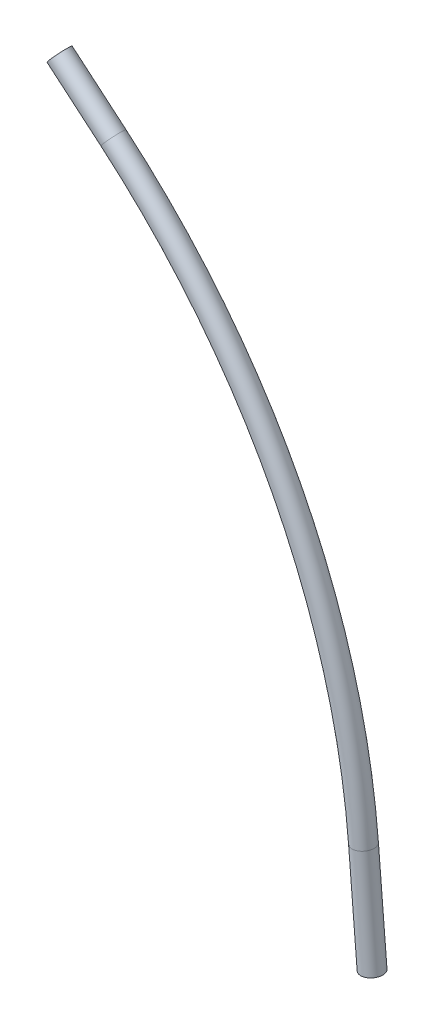
from build123d import *

# Parameters (mm, degrees)
VARREDURA1_PROFILE_R = 3


with BuildPart() as part:
    # Varredura1: sweep along a path in Esboço1
    with BuildLine(Plane.XY) as varredura1_path:
        Line((-135.865623535, 327.693536019), (-120.589838135, 314.78422231))
        ThreePointArc((-120.589838135, 314.78422231), (-71.379390853, 252.947335708), (-49.674968997, 176.957950014))
        Line((-49.674968997, 176.957950014), (-47.240621604, 147.056880588))
    # Varredura1 profile (on start of the path) → Varredura1 (sweep)
    with BuildSketch(Plane(origin=(-135.865623535, 327.693536019, 0), x_dir=(0.6454656854245487, 0.7637892699818567, 0), z_dir=(0.7637892699818567, -0.6454656854245487, 0))):
        Circle(VARREDURA1_PROFILE_R)
    sweep(path=varredura1_path.line)


solid = part.part
